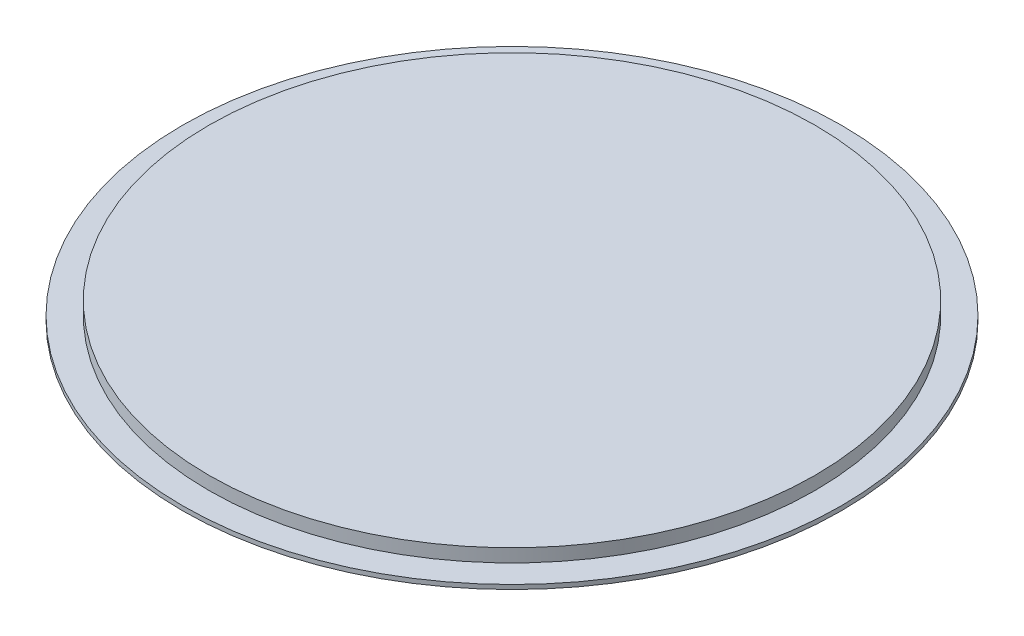
from build123d import *

# Parameters (mm, degrees)
SKETCH1_R           = 37.5
BOSS_EXTRUDE1_DEPTH = 1
SKETCH2_R           = 34.5
BOSS_EXTRUDE2_DEPTH = 3
FILLET1_R           = 5
SKETCH3_R           = 37.5
BOSS_EXTRUDE3_DEPTH = 0.5


with BuildPart() as part:
    # Sketch1 → Boss-Extrude1 (new body)
    with BuildSketch(Plane(origin=(0, 0, 0), x_dir=(1, 0, 0), z_dir=(0, 1, 0))):
        with Locations(Location((0, 0, 0), (0, 0, 270))):
            Circle(SKETCH1_R)
    extrude(amount=BOSS_EXTRUDE1_DEPTH)

    # Sketch2 → Boss-Extrude2 (add)
    with BuildSketch(Plane(origin=(0, 0, 0), x_dir=(1, 0, 0), z_dir=(0, 1, 0))):
        with Locations(Location((0, 0, 0), (0, 0, 270))):
            Circle(SKETCH2_R)
    extrude(amount=BOSS_EXTRUDE2_DEPTH)

    # Fillet1
    # the kernel refuses this fillet: 5 mm, written as the material it takes off along each edge
    with BuildSketch(Plane(origin=(0, 0, 0), x_dir=(0, 0, 1), z_dir=(-1, 0, 0))) as fillet1_piece_1:
        with BuildLine():
            CenterArc((34.5, 5), FILLET1_R, 270, 36.869897646)
            Line((34.5, 0), (34.5, -0.1))
            Line((34.5, -0.1), (37.5, -0.1))
            Line((37.5, -0.1), (37.6, 0))
            ThreePointArc((37.6, 0), (37.6, 0.5), (37.56, 0.92))
            Line((37.56, 0.92), (37.5, 1))
        make_face()
    revolve(axis=Axis((0, 0, 0), (0, 1, 0)), mode=Mode.SUBTRACT)

    # Sketch3 → Boss-Extrude3 (add)
    with BuildSketch(Plane(origin=(0, 1, 0), x_dir=(1, 0, 0), z_dir=(0, 1, 0))):
        with Locations(Location((0, 0, 0), (0, 0, 270))):
            Circle(SKETCH3_R)
    extrude(amount=BOSS_EXTRUDE3_DEPTH)


solid = part.part
